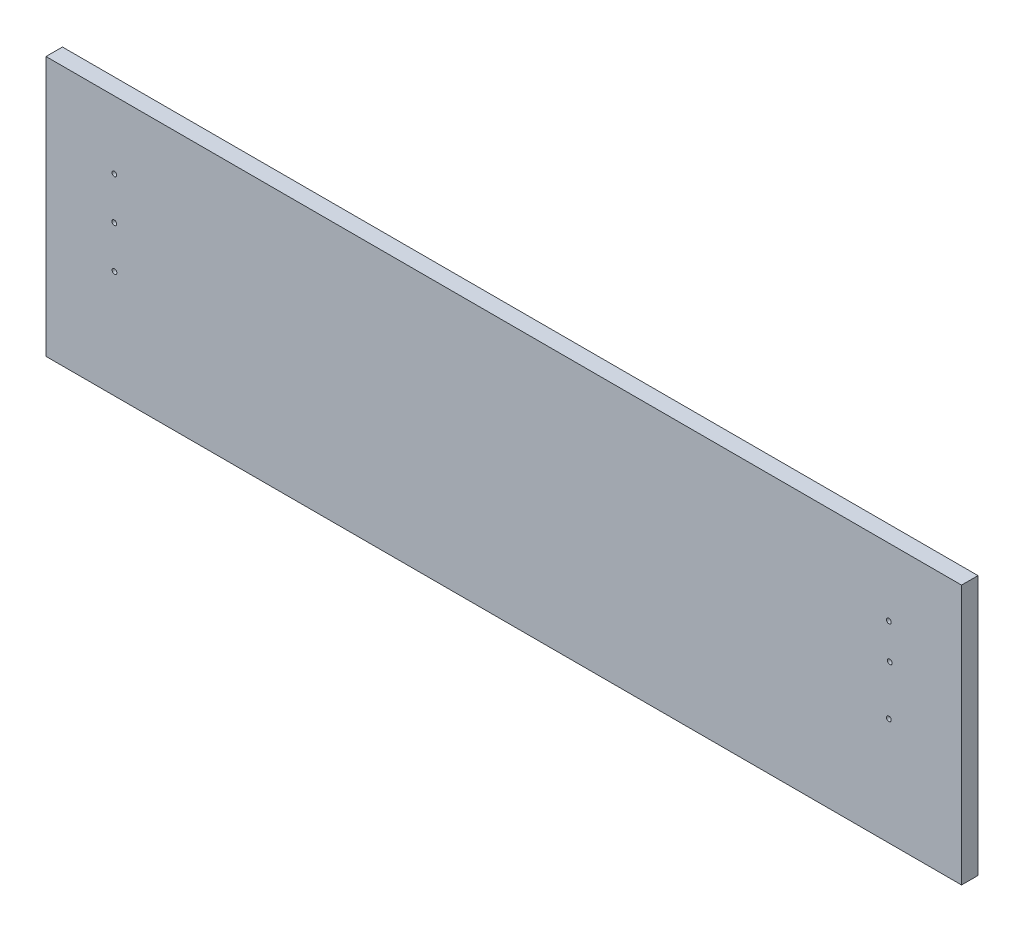
from build123d import *

# Parameters (mm, degrees)
SKETCH1_W                = 1057.46
SKETCH1_H                = 300
BOSS_EXTRUDE1_DEPTH      = 19
M5_CLEARANCE_HOLE1_D     = 5.5
M5_CLEARANCE_HOLE1_DEPTH = 32.347633298
M5_CLEARANCE_HOLE1_TIP   = 1.652366702


with BuildPart() as part:
    # Sketch1 → Boss-Extrude1 (new body)
    with BuildSketch(Plane.XY):
        with Locations((-1353.189241506, 653.735981281)):
            Rectangle(SKETCH1_W, SKETCH1_H)
    extrude(amount=BOSS_EXTRUDE1_DEPTH)

    # M5 Clearance Hole1
    with Locations(Plane(origin=(-1422.516740138, 243.837081497, 0), x_dir=(1, 0, 0), z_dir=(0, 0, -1))):
        with Locations((515.195405886, -441.758787463), (100.235099038, -718.93253129), (-182.477682784, -714.015727285), (514.111686068, -481.94291421), (514.111686068, -384.212918414), (-380.5099444, -481.94291421), (-380.5099444, -433.077472774), (-380.333128407, -384.438235192)):
            Hole(M5_CLEARANCE_HOLE1_D / 2, depth=M5_CLEARANCE_HOLE1_DEPTH)
            with Locations((0, 0, -(M5_CLEARANCE_HOLE1_DEPTH + M5_CLEARANCE_HOLE1_TIP / 2))):  # 118° drill point
                Cone(0, M5_CLEARANCE_HOLE1_D / 2, M5_CLEARANCE_HOLE1_TIP, mode=Mode.SUBTRACT)


solid = part.part
